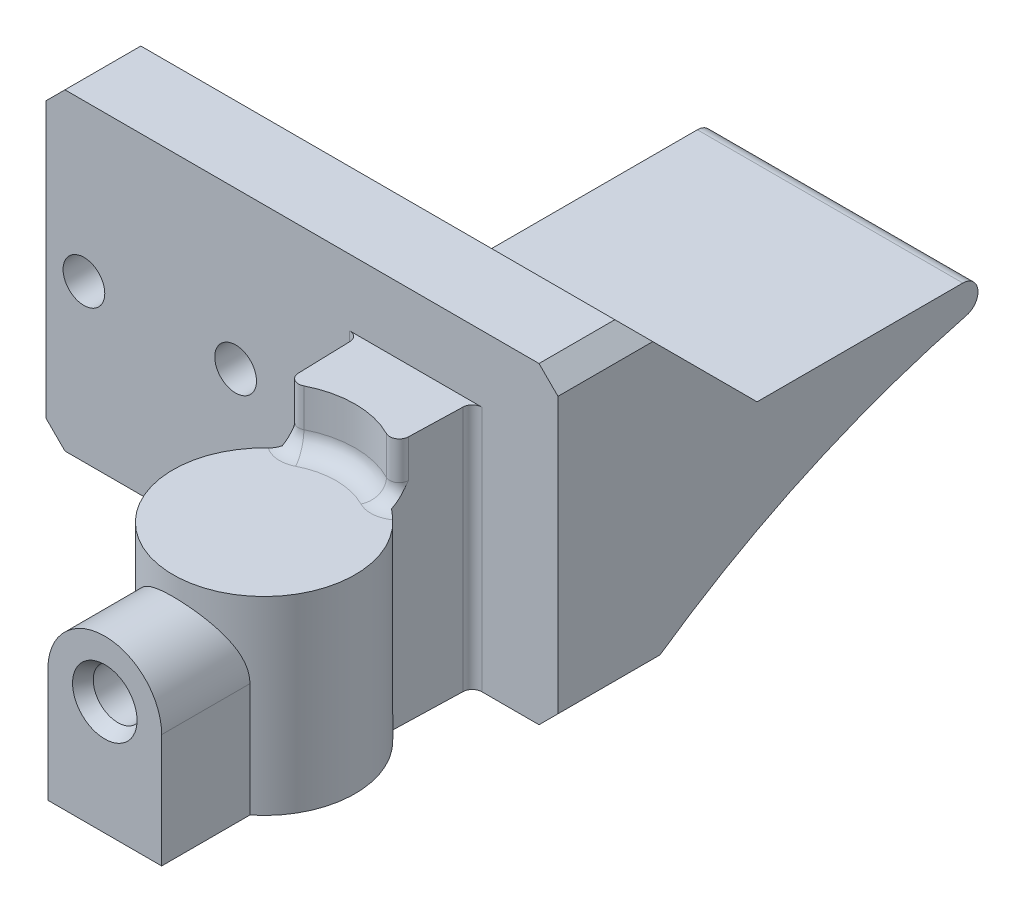
from build123d import *

# Parameters (mm, degrees)
SKETCH_1_W           = 27
SKETCH_1_H           = 16.5
EXTRUDE_1_DEPTH      = 4
SKETCH_2_R           = 1.1
CUT_EXTRUDE_1_DEPTH  = 4
SKETCH_3_R           = 4.8
EXTRUDE_2_DEPTH      = 10
EXTRUDE_3_DEPTH      = 13
FILLET_1_R           = 0.5
FILLET_2_R           = 1
EXTRUDE_4_REACH      = 29.807
EXTRUDE_4_END_RADIUS = 4.8
SKETCH_7_R           = 1.3
CUT_EXTRUDE_3_DEPTH  = 7
CHAMFER_1_SIZE       = 0.4
CHAMFER_1_SIZE2      = 0.692820323
FILLET_3_R           = 0.5
EXTRUDE_5_DEPTH      = 14
FILLET_4_R           = 0.5
CHAMFER_2_SIZE       = 1


with BuildPart() as part:
    # 草图1 → 凸台-拉伸1 (new body)
    with BuildSketch(Plane.XY):
        with Locations((3.5, 0)):
            Rectangle(SKETCH_1_W, SKETCH_1_H)
    extrude(amount=EXTRUDE_1_DEPTH)

    # 草图2 → 切除-拉伸1 (cut)
    with BuildSketch(Plane.XY.offset(4)):
        with Locations((-8, 0)):
            Circle(SKETCH_2_R)
        Circle(SKETCH_2_R)
    extrude(amount=-CUT_EXTRUDE_1_DEPTH, mode=Mode.SUBTRACT)



with BuildPart() as body_2:
    # 草图3 → 凸台-拉伸2 (new body)
    with BuildSketch(Plane.XZ.offset(8.25)):
        with Locations(Location((9.5, 12, 0), (0, 0, 270))):
            Circle(SKETCH_3_R)
    extrude(amount=-EXTRUDE_2_DEPTH)


with BuildPart() as part_1:
    add(part.part)

    add(body_2.part)  # 凸台-拉伸3 merges body 2
    # 草图4 → 凸台-拉伸3 (add)
    with BuildSketch(Plane.XZ.offset(8.25)):
        with BuildLine():
            Line((6.5, 4), (12.5, 4))
            Line((12.5, 4), (12.38, 8.16))
            ThreePointArc((12.38, 8.16), (9.5, 7.2), (6.62, 8.16))
            Line((6.62, 8.16), (6.5, 4))
        make_face()
    extrude(amount=-EXTRUDE_3_DEPTH)

    # 圆角1
    fillet_1_edges = [part_1.edges().sort_by_distance(p)[0] for p in [
        (6.62, 3.25, 8.16),
        (12.38, 3.25, 8.16),
    ]]
    fillet(fillet_1_edges, radius=FILLET_1_R)

    # 圆角2
    # the kernel refuses this fillet: 1 mm, written as the material it adds along each edge
    with BuildSketch(Plane(origin=(7.094742907, 1.75, 7.277210748), x_dir=(0.45382209295910925, 0, 0.891092311683932), z_dir=(0.891092311683932, 0, -0.45382209295910925))) as fillet_2_piece_1_section:
        with BuildLine():
            CenterArc((0.5 + FILLET_2_R, -FILLET_2_R), FILLET_2_R, 90, 90)
            Line((0.5, -FILLET_2_R), (0.5, 0))
            Line((0.5, 0), (0.5 + FILLET_2_R, 0))
        make_face()
    fillet_2_piece_1 = revolve(axis=Axis((7.094742907, 1.75, 7.277210748), (0, -1, 0)), revolution_arc=359.64, mode=Mode.PRIVATE)
    fillet_2_piece_1 = split(fillet_2_piece_1, bisect_by=Plane(origin=(6.594950803, 1.75, 7.291627828), z_dir=(0.9995842091710025, 0, -0.02883415987993323)), keep=Keep.TOP, mode=Mode.PRIVATE)
    add(fillet_2_piece_1)
    with BuildSketch(Plane(origin=(7.094742907, 1.75, 7.277210748), x_dir=(0.45382209295910925, 0, 0.891092311683932), z_dir=(0.891092311683932, 0, -0.45382209295910925))) as fillet_2_piece_2_section:
        with BuildLine():
            CenterArc((0.5 + FILLET_2_R, -FILLET_2_R), FILLET_2_R, 90, 90)
            Line((0.5, -FILLET_2_R), (0.5, 0))
            Line((0.5, 0), (0.5 + FILLET_2_R, 0))
        make_face()
    fillet_2_piece_2 = revolve(axis=Axis((7.094742907, 1.75, 7.277210748), (0, -1, 0)), revolution_arc=359.64, mode=Mode.PRIVATE)
    fillet_2_piece_2 = fillet_2_piece_2 & Plane(origin=(9.5, 1.75, 12), x_dir=(0.6, 0, -0.8000000000000002), z_dir=(0, -1, 0)) * Cylinder(4.8, 6, mode=Mode.PRIVATE)
    add(fillet_2_piece_2)
    with BuildSketch(Plane(origin=(11.905257093, 1.75, 7.277210748), x_dir=(-0.45941199618044226, 0, 0.8882232927397824), z_dir=(0.8882232927397824, 0, 0.45941199618044226))) as fillet_2_piece_3_section:
        with BuildLine():
            CenterArc((0.5 + FILLET_2_R, -FILLET_2_R), FILLET_2_R, 90, 90)
            Line((0.5 + FILLET_2_R, 0), (0.5, 0))
            Line((0.5, 0), (0.5, -FILLET_2_R))
        make_face()
    fillet_2_piece_3 = revolve(axis=Axis((11.905257093, 1.75, 7.277210748), (0, -1, 0)), revolution_arc=359.64, mode=Mode.PRIVATE)
    fillet_2_piece_3 = split(fillet_2_piece_3, bisect_by=Plane(origin=(12.405049197, 1.75, 7.291627828), z_dir=(-0.9995842091710025, 0, -0.02883415987993387)), keep=Keep.TOP, mode=Mode.PRIVATE)
    add(fillet_2_piece_3)
    with BuildSketch(Plane(origin=(11.905257093, 1.75, 7.277210748), x_dir=(-0.45941199618044226, 0, 0.8882232927397824), z_dir=(0.8882232927397824, 0, 0.45941199618044226))) as fillet_2_piece_4_section:
        with BuildLine():
            CenterArc((0.5 + FILLET_2_R, -FILLET_2_R), FILLET_2_R, 90, 90)
            Line((0.5 + FILLET_2_R, 0), (0.5, 0))
            Line((0.5, 0), (0.5, -FILLET_2_R))
        make_face()
    fillet_2_piece_4 = revolve(axis=Axis((11.905257093, 1.75, 7.277210748), (0, -1, 0)), revolution_arc=359.64, mode=Mode.PRIVATE)
    fillet_2_piece_4 = fillet_2_piece_4 & Plane(origin=(9.5, 1.75, 12), x_dir=(0.6, 0, -0.8000000000000002), z_dir=(0, -1, 0)) * Cylinder(4.8, 7, mode=Mode.PRIVATE)
    add(fillet_2_piece_4)
    with BuildSketch(Plane(origin=(9.5, 1.75, 12), x_dir=(-0.4538220929591119, 0, -0.8910923116839305), z_dir=(-0.8910923116839305, 0, 0.4538220929591119))) as fillet_2_piece_5:
        with BuildLine():
            CenterArc((4.8 - FILLET_2_R, -FILLET_2_R), FILLET_2_R, 0, 90)
            Line((4.8, -FILLET_2_R), (4.8, 0))
            Line((4.8, 0), (4.8 - FILLET_2_R, 0))
        make_face()
    revolve(axis=Axis((9.5, 1.75, 12), (0, -1, 0)), revolution_arc=53.978342396)

    # 凸台-拉伸4: up to this cylinder (the profile starts outside it)
    extrude_4_end = Plane(origin=(9.5, -4.045075, 12), z_dir=(0, -1, 0)) * Cylinder(EXTRUDE_4_END_RADIUS, 70.214, mode=Mode.PRIVATE)
    # 草图5 → 凸台-拉伸4 (add, up to the surface)
    with BuildSketch(Plane.XY.offset(20.4), mode=Mode.PRIVATE) as extrude_4_sk1:
        with BuildLine():
            Line((6.5, -8.25), (6.5, -2.25))
            ThreePointArc((6.5, -2.25), (9.5, 0.75), (12.5, -2.25))
            Line((12.5, -2.25), (12.5, -8.25))
            Line((12.5, -8.25), (6.5, -8.25))
        make_face()
    extrude_4_tool1 = extrude(extrude_4_sk1.sketch, amount=-EXTRUDE_4_REACH, mode=Mode.PRIVATE) - extrude_4_end
    add(extrude_4_tool1.solids().sort_by_distance((9.5, -4.045075, 20.4))[0])

    # 草图7 → 切除-拉伸3 (cut)
    with BuildSketch(Plane.XY.offset(20.4)):
        with Locations((9.5, -2.25)):
            Circle(SKETCH_7_R)
    extrude(amount=-CUT_EXTRUDE_3_DEPTH, mode=Mode.SUBTRACT)

    # 倒角1
    chamfer_1_edges = [part_1.edges().sort_by_distance(p)[0] for p in [
        (8.2, -2.25, 20.4),
    ]]
    chamfer_1_side = [part_1.faces().sort_by_distance(p)[0] for p in [
        (9.5, -4.257679358, 20.4),
    ]]
    chamfer(chamfer_1_edges, length=CHAMFER_1_SIZE, length2=CHAMFER_1_SIZE2, reference=chamfer_1_side[0])

    # 圆角3
    fillet_3_edges = [part_1.edges().sort_by_distance(p)[0] for p in [
        (6.5, -1.75, 4),
        (12.5, -1.75, 4),
    ]]
    fillet(fillet_3_edges, radius=FILLET_3_R)

    # 草图8 → 凸台-拉伸5 (add)
    with BuildSketch(Plane(origin=(17, 0, 0), x_dir=(0, 0, -1), z_dir=(1, 0, 0))):
        with BuildLine():
            Line((6.5, 1.75), (17.350889359, 1.75))
            ThreePointArc((17.350889359, 1.75), (18.144565149, 1.050392929), (17.550087952, 0.17519685))
            ThreePointArc((17.550087952, 0.17519685), (8.361036446, -3.17500409), (0, -8.25))
            Line((0, -8.25), (0, 8.25))
            Line((0, 8.25), (6.5, 1.75))
        make_face()
    extrude(amount=-EXTRUDE_5_DEPTH)

    # 圆角4
    # the kernel refuses this fillet: 0.5 mm, written as the material it adds along each edge
    with BuildSketch(Plane(origin=(3, -8.25, 0), x_dir=(-1, 0, 0), z_dir=(0, 1, 0))) as fillet_4_piece_1_section:
        with BuildLine():
            CenterArc((FILLET_4_R, -FILLET_4_R), FILLET_4_R, 90, 90)
            Line((0, -FILLET_4_R), (0, 0))
            Line((0, 0), (FILLET_4_R, 0))
        make_face()
    fillet_4_piece_1 = extrude(amount=16.5, mode=Mode.PRIVATE)
    fillet_4_piece_1 = fillet_4_piece_1 - Plane(origin=(3, -48.25, -30), x_dir=(0, 0.9685039370078732, 0.24899824095814338), z_dir=(1, 0, 0)) * Cylinder(50, 35, mode=Mode.PRIVATE)
    fillet_4_piece_1 = split(fillet_4_piece_1, bisect_by=Plane(origin=(3, 0, -8.25), z_dir=(0, -0.7071067811865462, 0.7071067811865488)), keep=Keep.TOP, mode=Mode.PRIVATE)
    add(fillet_4_piece_1)

    # 倒角2
    chamfer_2_edges = [part_1.edges().sort_by_distance(p)[0] for p in [
        (-10, 8.25, 2),
        (17, 8.25, 2),
        (17, -8.25, 2),
        (-10, -8.25, 2),
    ]]
    chamfer(chamfer_2_edges, length=CHAMFER_2_SIZE)


solid = part_1.part
